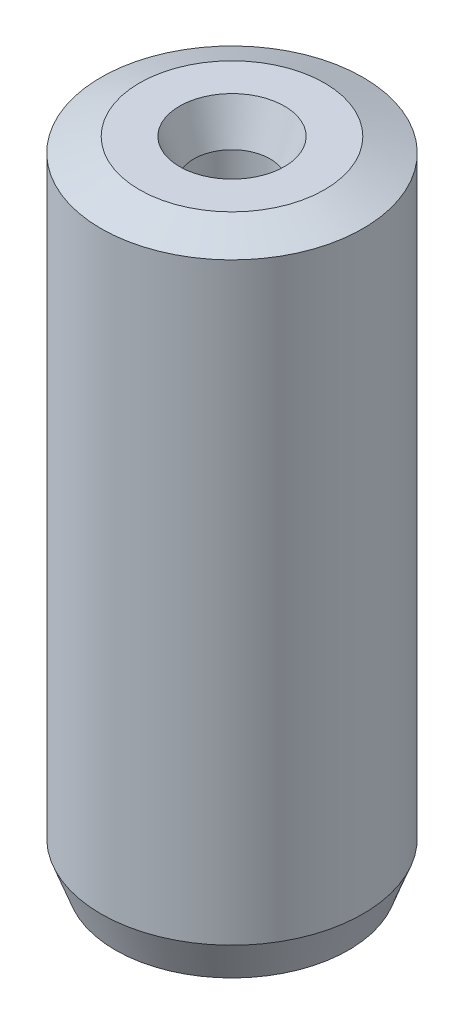
from build123d import *
from OCP.BRepFilletAPI import BRepFilletAPI_MakeChamfer

# Parameters (mm, degrees)
SKETCH1_R           = 5
BOSS_EXTRUDE1_DEPTH = 24.669197182
SKETCH2_R           = 1.453288671
CUT_EXTRUDE1_DEPTH  = 26.662604887
CHAMFER1_SIZE       = 0.548105346
CHAMFER1_SIZE2      = 1.469003308


with BuildPart() as part:
    # Sketch1 → Boss-Extrude1 (new body)
    with BuildSketch(Plane(origin=(0, 0, 0), x_dir=(1, 0, 0), z_dir=(0, 1, 0))):
        Circle(SKETCH1_R)
    extrude(amount=BOSS_EXTRUDE1_DEPTH)

    # Sketch2 → Cut-Extrude1 (cut, through all)
    with BuildSketch(Plane(origin=(0, 0, 0), x_dir=(1, 0, 0), z_dir=(0, 1, 0))):
        Circle(SKETCH2_R)
    extrude(amount=CUT_EXTRUDE1_DEPTH, mode=Mode.SUBTRACT)

    # Chamfer1: one chamfer whose edges measure the first distance from different faces: ONE call of the kernel's chamfer builder (chamfer() names one face for all edges)
    chamfer1_edges_1 = [part.edges().sort_by_distance(p)[0] for p in [
        (-1.453288671, 24.669197182, 0),
    ]]
    chamfer1_side_1 = [part.faces().sort_by_distance(p)[0] for p in [
        (-4.858578644, 24.669197182, 0),
    ]]
    chamfer1_edges_2 = [part.edges().sort_by_distance(p)[0] for p in [
        (-1.453288671, 0, 0),
    ]]
    chamfer1_side_2 = [part.faces().sort_by_distance(p)[0] for p in [
        (-1.453288671, 12.334598591, 0),
    ]]
    chamfer1_edges_3 = [part.edges().sort_by_distance(p)[0] for p in [
        (-5, 0, 0),
    ]]
    chamfer1_side_3 = [part.faces().sort_by_distance(p)[0] for p in [
        (-4.858578644, 0, 0),
    ]]
    chamfer1_edges_4 = [part.edges().sort_by_distance(p)[0] for p in [
        (-5, 24.669197182, 0),
    ]]
    chamfer1_side_4 = [part.faces().sort_by_distance(p)[0] for p in [
        (-5, 12.334598591, 0),
    ]]
    chamfer1 = BRepFilletAPI_MakeChamfer(part.part.solid().wrapped)
    for e in chamfer1_edges_1:
        chamfer1.Add(CHAMFER1_SIZE, CHAMFER1_SIZE2, e.wrapped, chamfer1_side_1[0].wrapped)  # the first distance lies on this face
    for e in chamfer1_edges_2:
        chamfer1.Add(CHAMFER1_SIZE, CHAMFER1_SIZE2, e.wrapped, chamfer1_side_2[0].wrapped)  # the first distance lies on this face
    for e in chamfer1_edges_3:
        chamfer1.Add(CHAMFER1_SIZE, CHAMFER1_SIZE2, e.wrapped, chamfer1_side_3[0].wrapped)  # the first distance lies on this face
    for e in chamfer1_edges_4:
        chamfer1.Add(CHAMFER1_SIZE, CHAMFER1_SIZE2, e.wrapped, chamfer1_side_4[0].wrapped)  # the first distance lies on this face
    add(Compound.cast(chamfer1.Shape()), mode=Mode.REPLACE)


solid = part.part
